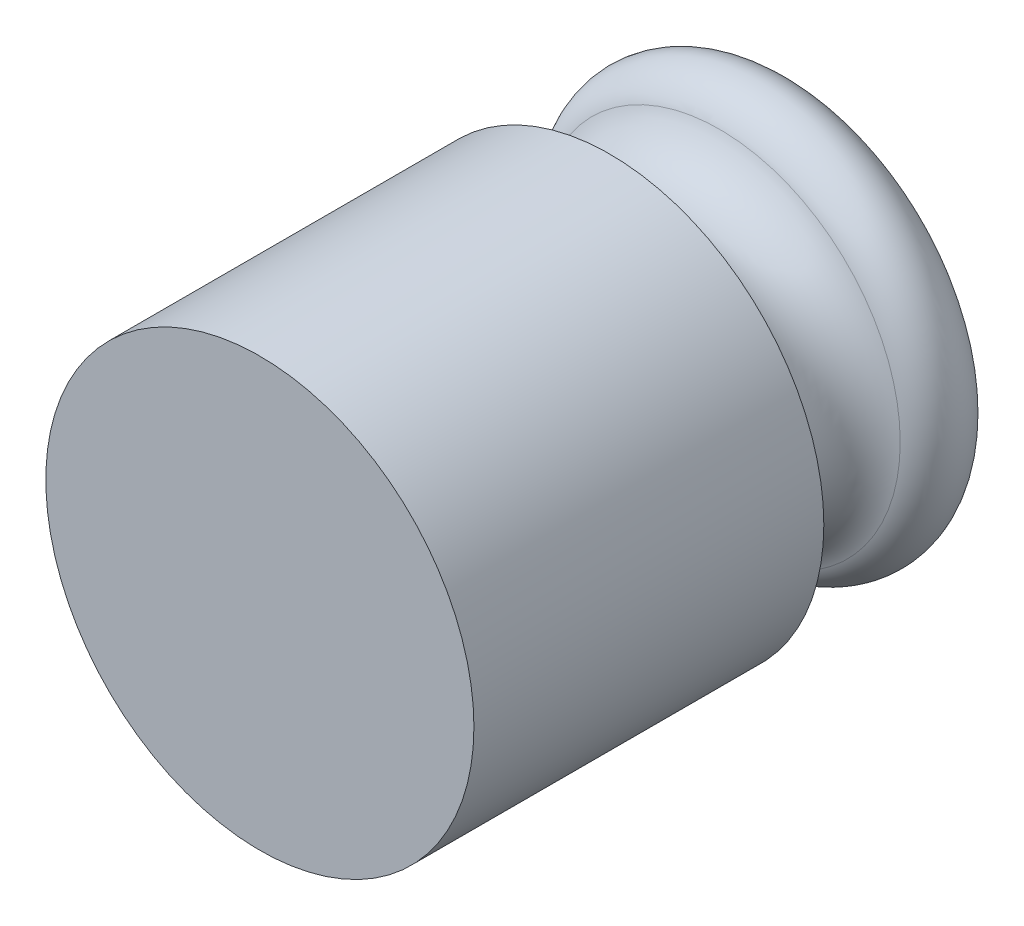
from build123d import *

# Parameters (mm, degrees)
SKETCH1_R           = 15.6
BOSS_EXTRUDE1_DEPTH = 12.75


with BuildPart() as part:
    # Sketch1 → Boss-Extrude1 (new, symmetric)
    with BuildSketch(Plane.XY):
        Circle(SKETCH1_R)
    extrude(amount=BOSS_EXTRUDE1_DEPTH, both=True)

    # Sketch2 → Revolve1 (revolve)
    with BuildSketch(Plane(origin=(0, 0, 0), x_dir=(0, 0, -1), z_dir=(1, 0, 0))):
        with BuildLine():
            Line((12.75, 0), (20.75, 0))
            Line((20.75, 0), (26.25, 0))
            Line((26.25, 0), (26.25, 12.157397862))
            ThreePointArc((26.25, 12.157397862), (23.920458322, 14.953315579), (20.75, 13.166666667))
            ThreePointArc((20.75, 13.166666667), (16.138424259, 10.567904613), (12.75, 14.634694019))
            Line((12.75, 14.634694019), (12.75, 0))
        make_face()
    revolve(axis=Axis((0, 0, -12.75), (0, 0, -1)))


solid = part.part
